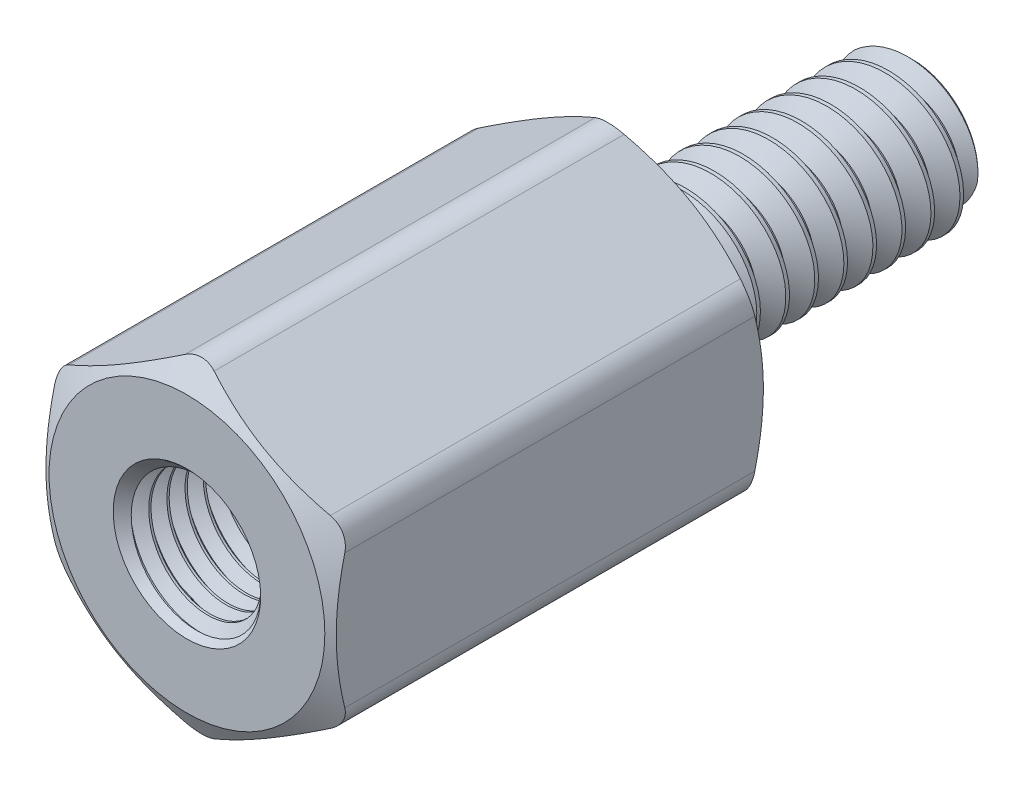
from build123d import *

# Parameters (mm, degrees)
SKETCH4_R           = 4.7625
BOSS_EXTRUDE1_DEPTH = 19.05
SKETCH5_OUTSIDE_W   = 140.61
SKETCH5_OUTSIDE_H   = 142.574
SKETCH5_OUTSIDE_R   = 6.0325
CUT_EXTRUDE1_DEPTH  = 34.198619449
CUT_EXTRUDE1_DRAFT  = -60
SKETCH6_OUTSIDE_W   = 99.658
SKETCH6_OUTSIDE_H   = 101.622
SKETCH6_OUTSIDE_R   = 6.0325
CUT_EXTRUDE2_DEPTH  = 22.377285453
CUT_EXTRUDE2_DRAFT  = -60
FILLET1_R           = 1.27
CUT_SWEEP1_PITCH    = 1.27
SKETCH9_R           = 3.4925
BOSS_EXTRUDE2_DEPTH = 13.1064
SKETCH10_W          = 13.1064
SKETCH10_H          = 3.175
CUT_SWEEP2_PITCH    = 0.79375


with BuildPart() as part:
    # Sketch3 → Revolve1 (revolve)
    with BuildSketch(Plane(origin=(0, 0, 0), x_dir=(0, 0, -1), z_dir=(1, 0, 0))):
        with BuildLine():
            Line((-5.9436, 2.8575), (-5.9436, 0))
            Line((-5.9436, 0), (12.7, 0))
            Line((12.7, 0), (12.7, 2.8575))
            Line((12.7, 2.8575), (12.3825, 3.175))
            Line((12.3825, 3.175), (2.00025, 3.175))
            Line((2.00025, 3.175), (1.524, 2.350110803))
            Line((1.524, 2.350110803), (0.3175, 2.350110803))
            ThreePointArc((0.3175, 2.350110803), (0.092993597, 2.4431044), (0, 2.667610803))
            Line((0, 2.667610803), (0, 6.35))
            Line((0, 6.35), (-19.05, 6.35))
            Line((-19.05, 6.35), (-19.05, 3.4925))
            Line((-19.05, 3.4925), (-18.7325, 3.175))
            Line((-18.7325, 3.175), (-6.2611, 3.175))
            Line((-6.2611, 3.175), (-5.9436, 2.8575))
        make_face()
    revolve(axis=Axis((0, 0, -12.7), (0, 0, 1)))

    # Sketch4 → Boss-Extrude1 (add)
    with BuildSketch(Plane.XY.offset(19.05)):
        Polygon((-6.35, 3.666174209), (-6.35, -3.666174209), (0, -7.332348419), (6.35, -3.666174209), (6.35, 3.666174209), (0, 7.332348419), align=None)
        Circle(SKETCH4_R, mode=Mode.SUBTRACT)
    extrude(amount=-BOSS_EXTRUDE1_DEPTH)


with BuildPart() as cut_extrude1_tool:
    # Sketch5 outside → Cut-Extrude1 (with draft: the straight prism first)
    with BuildSketch(Plane.XY.offset(19.05)):
        Rectangle(SKETCH5_OUTSIDE_W, SKETCH5_OUTSIDE_H)
        Circle(SKETCH5_OUTSIDE_R, mode=Mode.SUBTRACT)
    extrude(amount=-CUT_EXTRUDE1_DEPTH)
    # Cut-Extrude1: the draft: its side faces are tilted about the plane it starts from
    cut_extrude1_sides = [cut_extrude1_tool.faces().sort_by_distance(p)[0] for p in [
        (0, -71.287, 1.950690275),
        (70.305, 0, 1.950690275),
        (0, 71.287, 1.950690275),
        (-70.305, 0, 1.950690275),
        (-6.0325, 0, 1.950690275),
    ]]
    draft(cut_extrude1_sides, Plane.XY.offset(19.05), CUT_EXTRUDE1_DRAFT)


with BuildPart() as part_1:
    add(part.part)

    # Cut-Extrude1: cut by cut_extrude1_tool
    add(cut_extrude1_tool.part, mode=Mode.SUBTRACT)


with BuildPart() as cut_extrude2_tool:
    # Sketch6 outside → Cut-Extrude2 (with draft: the straight prism first)
    with BuildSketch(Plane(origin=(0, 0, 0), x_dir=(-1, 0, 0), z_dir=(0, 0, -1))):
        Rectangle(SKETCH6_OUTSIDE_W, SKETCH6_OUTSIDE_H)
        Circle(SKETCH6_OUTSIDE_R, mode=Mode.SUBTRACT)
    extrude(amount=-CUT_EXTRUDE2_DEPTH)
    # Cut-Extrude2: the draft: its side faces are tilted about the plane it starts from
    cut_extrude2_sides = [cut_extrude2_tool.faces().sort_by_distance(p)[0] for p in [
        (0, -50.811, 11.188642726),
        (-49.829, 0, 11.188642726),
        (0, 50.811, 11.188642726),
        (49.829, 0, 11.188642726),
        (6.0325, 0, 11.188642726),
    ]]
    draft(cut_extrude2_sides, Plane(origin=(0, 0, 0), x_dir=(-1, 0, 0), z_dir=(0, 0, -1)), CUT_EXTRUDE2_DRAFT)


with BuildPart() as part_2:
    add(part_1.part)

    # Cut-Extrude2: cut by cut_extrude2_tool
    add(cut_extrude2_tool.part, mode=Mode.SUBTRACT)

    # Fillet1
    fillet1_edges = [part_2.edges().sort_by_distance(p)[0] for p in [
        (0, 7.332348419, 9.525),
        (-6.35, -3.666174209, 9.525),
        (0, -7.332348419, 9.525),
        (6.35, -3.666174209, 9.525),
        (6.35, 3.666174209, 9.525),
        (-6.35, 3.666174209, 9.525),
    ]]
    fillet(fillet1_edges, radius=FILLET1_R)

    # Cut-Sweep1: the profile of Sketch7 profile screwed along a right-hand helix of 9.7 turns, 8 arcs to a turn; built about Z, then put on its axis
    cut_sweep1_z = Axis((0, 0, 0), (0, 0, 1))
    cut_sweep1_corners = [(2.349810803, 0, -0.476423205), (2.349810803, 0, -0.634826795), (3.243740766, 0, -1.1509375), (3.243740766, 0, 0.0396875)]
    with BuildLine(mode=Mode.PRIVATE) as cut_sweep1_profile:
        Line(cut_sweep1_corners[0], cut_sweep1_corners[1])
        Line(cut_sweep1_corners[1], cut_sweep1_corners[2])
        Line(cut_sweep1_corners[2], cut_sweep1_corners[3])
        Line(cut_sweep1_corners[3], cut_sweep1_corners[0])
    cut_sweep1_cap = Face(cut_sweep1_profile.wire())
    cut_sweep1_turn_angles = [0, 22.5, 45, 67.5, 90, 112.5, 135, 157.5, 180, 202.5, 225, 247.5, 270, 292.5, 315, 337.5, 360]
    cut_sweep1_turn_weights = [1, 0.9238795325112867, 1, 0.9238795325112867, 1, 0.9238795325112867, 1, 0.9238795325112867, 1, 0.9238795325112867, 1, 0.9238795325112867, 1, 0.9238795325112867, 1, 0.9238795325112867, 1]
    cut_sweep1_turn_rails = [Edge.make_bspline([Vector(p[0], p[1], 0).rotate(cut_sweep1_z, cut_sweep1_turn_angles[k]) / cut_sweep1_turn_weights[k] + Vector(0, 0, p[2] + CUT_SWEEP1_PITCH * cut_sweep1_turn_angles[k] / 360) for k in range(17)], [0, 0, 0, 1, 1, 2, 2, 3, 3, 4, 4, 5, 5, 6, 6, 7, 7, 8, 8, 8], 2, cut_sweep1_turn_weights) for p in cut_sweep1_corners]
    cut_sweep1_turn_sides = [Face.make_surface_from_curves(cut_sweep1_turn_rails[p[0]], cut_sweep1_turn_rails[p[1]]) for p in [(0, 1), (1, 2), (2, 3), (3, 0)]]
    cut_sweep1_last_angles = [3240, 3262.5, 3285, 3307.5, 3330, 3352.5, 3375, 3397.5, 3420, 3442.5, 3465, 3478.5, 3492]
    cut_sweep1_last_weights = [1, 0.9238795325112867, 1, 0.9238795325112867, 1, 0.9238795325112867, 1, 0.9238795325112867, 1, 0.9238795325112867, 1, 0.972369920397634, 1]
    cut_sweep1_last_rails = [Edge.make_bspline([Vector(p[0], p[1], 0).rotate(cut_sweep1_z, cut_sweep1_last_angles[k]) / cut_sweep1_last_weights[k] + Vector(0, 0, p[2] + CUT_SWEEP1_PITCH * cut_sweep1_last_angles[k] / 360) for k in range(13)], [0, 0, 0, 1, 1, 2, 2, 3, 3, 4, 4, 5, 5, 6, 6, 6], 2, cut_sweep1_last_weights) for p in cut_sweep1_corners]
    cut_sweep1_last_sides = [Face.make_surface_from_curves(cut_sweep1_last_rails[p[0]], cut_sweep1_last_rails[p[1]]) for p in [(0, 1), (1, 2), (2, 3), (3, 0)]]
    cut_sweep1 = Plane(origin=(0, 0, -12.7), x_dir=(0, 1, 0), z_dir=(0, 0, 1)) * Solid(Shell([*[p.moved(Location((0, 0, CUT_SWEEP1_PITCH * i))) for i in range(9) for p in cut_sweep1_turn_sides], *cut_sweep1_last_sides, cut_sweep1_cap, cut_sweep1_cap.rotate(cut_sweep1_z, 3492).moved(Location((0, 0, CUT_SWEEP1_PITCH * 3492 / 360)))]))
    add(cut_sweep1, mode=Mode.SUBTRACT)

    # Sketch9 → Boss-Extrude2 (add)
    with BuildSketch(Plane.XY.offset(5.9436)):
        Circle(SKETCH9_R)
    extrude(amount=BOSS_EXTRUDE2_DEPTH)


with BuildPart() as body_2:
    # Sketch10 → Revolve2 (revolve)
    with BuildSketch(Plane(origin=(0, 0, 0), x_dir=(0, 0, -1), z_dir=(1, 0, 0))):
        with Locations((-12.4968, 1.5875)):
            Rectangle(SKETCH10_W, SKETCH10_H)
    revolve(axis=Axis((0, 0, -12.7), (0, 0, 1)))

    # Cut-Sweep2: the profile of Sketch12 screwed along a right-hand helix of 17.512 turns, 8 arcs to a turn; built about Z, then put on its axis
    cut_sweep2_z = Axis((0, 0, 0), (0, 0, 1))
    cut_sweep2_corners = [(2.659444252, 0, -0.396875), (2.659444252, 0, -0.29765625), (3.217962979, 0, 0.024804687), (3.217962979, 0, -0.719335938)]
    with BuildLine(mode=Mode.PRIVATE) as cut_sweep2_profile:
        Line(cut_sweep2_corners[0], cut_sweep2_corners[1])
        Line(cut_sweep2_corners[1], cut_sweep2_corners[2])
        Line(cut_sweep2_corners[2], cut_sweep2_corners[3])
        Line(cut_sweep2_corners[3], cut_sweep2_corners[0])
    cut_sweep2_cap = Face(cut_sweep2_profile.wire())
    cut_sweep2_turn_angles = [0, 22.5, 45, 67.5, 90, 112.5, 135, 157.5, 180, 202.5, 225, 247.5, 270, 292.5, 315, 337.5, 360]
    cut_sweep2_turn_weights = [1, 0.9238795325112867, 1, 0.9238795325112867, 1, 0.9238795325112867, 1, 0.9238795325112867, 1, 0.9238795325112867, 1, 0.9238795325112867, 1, 0.9238795325112867, 1, 0.9238795325112867, 1]
    cut_sweep2_turn_rails = [Edge.make_bspline([Vector(p[0], p[1], 0).rotate(cut_sweep2_z, cut_sweep2_turn_angles[k]) / cut_sweep2_turn_weights[k] + Vector(0, 0, p[2] + CUT_SWEEP2_PITCH * cut_sweep2_turn_angles[k] / 360) for k in range(17)], [0, 0, 0, 1, 1, 2, 2, 3, 3, 4, 4, 5, 5, 6, 6, 7, 7, 8, 8, 8], 2, cut_sweep2_turn_weights) for p in cut_sweep2_corners]
    cut_sweep2_turn_sides = [Face.make_surface_from_curves(cut_sweep2_turn_rails[p[0]], cut_sweep2_turn_rails[p[1]]) for p in [(0, 1), (1, 2), (2, 3), (3, 0)]]
    cut_sweep2_last_angles = [6120, 6142.5, 6165, 6187.5, 6210, 6232.5, 6255, 6277.5, 6300, 6302.16, 6304.32]
    cut_sweep2_last_weights = [1, 0.9238795325112867, 1, 0.9238795325112867, 1, 0.9238795325112867, 1, 0.9238795325112867, 1, 0.9992894726405699, 1]
    cut_sweep2_last_rails = [Edge.make_bspline([Vector(p[0], p[1], 0).rotate(cut_sweep2_z, cut_sweep2_last_angles[k]) / cut_sweep2_last_weights[k] + Vector(0, 0, p[2] + CUT_SWEEP2_PITCH * cut_sweep2_last_angles[k] / 360) for k in range(11)], [0, 0, 0, 1, 1, 2, 2, 3, 3, 4, 4, 5, 5, 5], 2, cut_sweep2_last_weights) for p in cut_sweep2_corners]
    cut_sweep2_last_sides = [Face.make_surface_from_curves(cut_sweep2_last_rails[p[0]], cut_sweep2_last_rails[p[1]]) for p in [(0, 1), (1, 2), (2, 3), (3, 0)]]
    cut_sweep2 = Plane(origin=(0, 0, 19.05), x_dir=(0, 1, 0), z_dir=(0, 0, -1)) * Solid(Shell([*[p.moved(Location((0, 0, CUT_SWEEP2_PITCH * i))) for i in range(17) for p in cut_sweep2_turn_sides], *cut_sweep2_last_sides, cut_sweep2_cap, cut_sweep2_cap.rotate(cut_sweep2_z, 6304.32).moved(Location((0, 0, CUT_SWEEP2_PITCH * 6304.32 / 360)))]))
    add(cut_sweep2, mode=Mode.SUBTRACT)


with BuildPart() as part_3:
    add(part_2.part)

    # Combine1: cut body 2
    add(body_2.part, mode=Mode.SUBTRACT)

    # Cut-Extrude3 cone 1 section (through the dimple's axis) → Cut-Extrude3 (revolve, cut)
    with BuildSketch(Plane(origin=(0, 0, 19.05), x_dir=(0, -1, 0), z_dir=(1, 0, 0))):
        Polygon((0, 0), (3.2258, 0), (0, 3.2258), align=None)
    revolve(axis=Axis((0, 0, 19.05), (0, 0, -1)), mode=Mode.SUBTRACT)


solid = part_3.part
